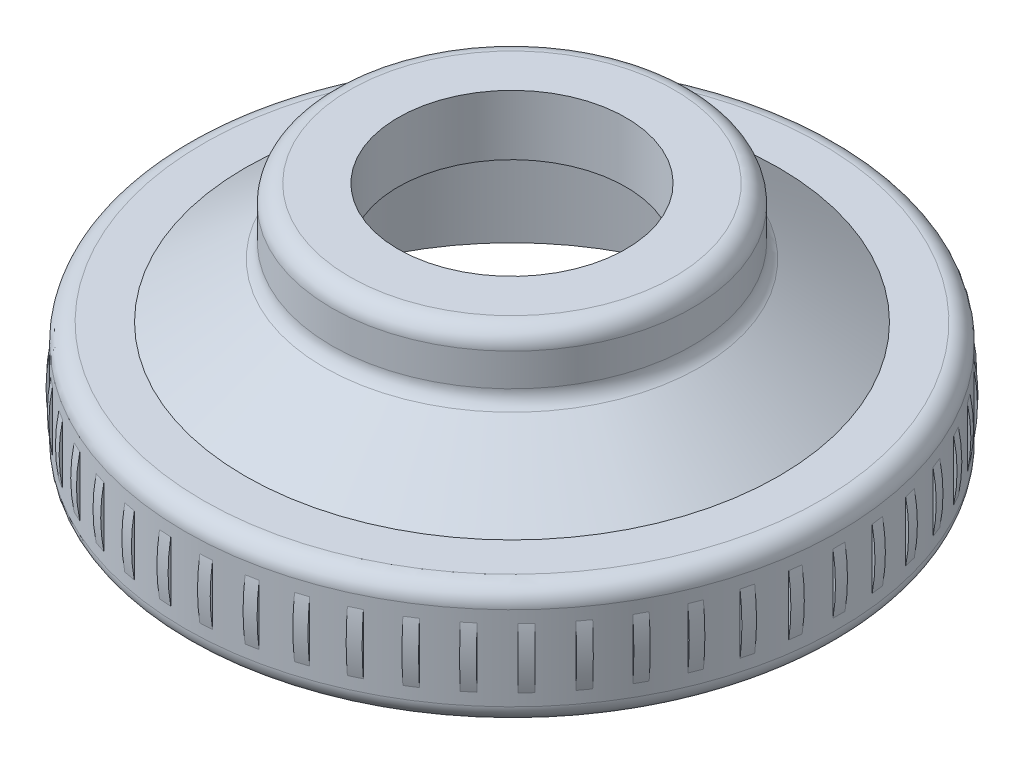
from build123d import *

# Parameters (mm, degrees)
SKETCH1_R                = 27.225
SKETCH1_R_2              = 22.225
BOSS_EXTRUDE1_DEPTH      = 10
SKETCH5_R                = 15
BOSS_EXTRUDE3_DEPTH      = 5
SKETCH9_W                = 9.4869
SKETCH9_H                = 20
FILLET3_R                = 1.5
FILLET5_R                = 1.5
BOSS_EXTRUDE4_DEPTH      = 0.5
BOSS_EXTRUDE4_DEPTH_BACK = 0.5
FILLET6_R                = 15
CIRPATTERN2_COUNT        = 50


with BuildPart() as part:
    # Sketch1 → Boss-Extrude1 (new body)
    with BuildSketch(Plane(origin=(0, 0, 0), x_dir=(1, 0, 0), z_dir=(0, 1, 0))):
        with Locations(Location((0, 0, 0), (0, 0, 270))):
            Circle(SKETCH1_R)
        with Locations(Location((0, 0, 0), (0, 0, 270))):
            Circle(SKETCH1_R_2, mode=Mode.SUBTRACT)
    extrude(amount=BOSS_EXTRUDE1_DEPTH)

    # Fillet5
    fillet5_edges = [part.edges().sort_by_distance(p)[0] for p in [
        (0, 0, -27.225),
        (0, 10, -27.225),
    ]]
    fillet(fillet5_edges, radius=FILLET5_R)


with BuildPart() as body_2:
    # Revolve1: read off the stored shape, not the designer's step
    # Revolve1 outline → Revolve1 (revolve)
    with BuildSketch(Plane.XY):
        Polygon((10, 15), (17.225, 10), (22.225, 10), (15, 15), align=None)
    revolve(axis=Axis((0, 0, 0), (0, 1, 0)))



with BuildPart() as body_3:
    # Revolve1 2 outline → Revolve1 2 (revolve)
    with BuildSketch(Plane.XY):
        Polygon((15, 15), (10, 15), (17.225, 10), (22.225, 10), align=None)
    revolve(axis=Axis((0, 0, 0), (0, 1, 0)))


with BuildPart() as body_2_1:
    add(body_2.part)

    add(body_3.part)  # Boss-Extrude3 merges body 3
    # Sketch5 → Boss-Extrude3 (add)
    with BuildSketch(Plane(origin=(0, 15, 0), x_dir=(1, 0, 0), z_dir=(0, 1, 0))):
        with Locations(Location((0, 0, 0), (0, 0, 270))):
            Circle(SKETCH5_R)
    extrude(amount=BOSS_EXTRUDE3_DEPTH)

    # Sketch9 → Taladro roscado 1/2-14 NPSM1 (revolve, cut)
    with BuildSketch(Plane(origin=(0, 20, 0), x_dir=(0, 0, 1), z_dir=(1, 0, 0))):
        with Locations((4.74345, 10)):
            Rectangle(SKETCH9_W, SKETCH9_H)
    revolve(axis=Axis((0, 26.35, 0), (0, -1, 0)), mode=Mode.SUBTRACT)

    # Fillet3
    fillet3_edges = [body_2_1.edges().sort_by_distance(p)[0] for p in [
        (0, 20, -15),
        (-10.606601718, 15, -10.606601718),
    ]]
    fillet(fillet3_edges, radius=FILLET3_R)


with BuildPart() as body_3_2:
    # Sketch10 → Boss-Extrude4 (new, two sides: drawn at the far end of the back side and taken through both)
    with BuildSketch(Plane.XY.offset(-BOSS_EXTRUDE4_DEPTH_BACK)):
        Polygon((27.225, 7.5), (27.675, 5), (27.225, 2.5), align=None)
    extrude(amount=BOSS_EXTRUDE4_DEPTH + BOSS_EXTRUDE4_DEPTH_BACK)

    # Fillet6
    # the kernel refuses this fillet: 15 mm, written as the material it takes off along each edge
    with BuildSketch(Plane(origin=(27.675, 5, 7.243714089), x_dir=(-0.17715299831526438, 0.9841833239736956, 0), z_dir=(0, 0, -1))) as fillet6_piece_1:
        with BuildLine():
            CenterArc((2.697485635, -15), FILLET6_R, 90, 19.788455744)
            Line((-2.380739461, -0.885764992), (-2.482303963, -0.603480291))
            ThreePointArc((-2.482303963, -0.603480291), (-1.294980346, -0.161712407), (-0.104610616, 0.281170089))
            Line((-0.104610616, 0.281170089), (0, 0.3))
            Line((0, 0.3), (2.697485635, 0.3))
            Line((2.697485635, 0.3), (2.697485635, 0))
        make_face()
    extrude(amount=14.487428177, mode=Mode.SUBTRACT)


with BuildPart() as cirpattern2_1:
    # CirPattern2: pattern copy
    add(body_3_2.part.rotate(Axis((0, 0, 0), (0, 1, 0)), 1 * 360 / CIRPATTERN2_COUNT))


with BuildPart() as cirpattern2_2:
    # CirPattern2: pattern copy
    add(body_3_2.part.rotate(Axis((0, 0, 0), (0, 1, 0)), 2 * 360 / CIRPATTERN2_COUNT))


with BuildPart() as cirpattern2_3:
    # CirPattern2: pattern copy
    add(body_3_2.part.rotate(Axis((0, 0, 0), (0, 1, 0)), 3 * 360 / CIRPATTERN2_COUNT))


with BuildPart() as cirpattern2_4:
    # CirPattern2: pattern copy
    add(body_3_2.part.rotate(Axis((0, 0, 0), (0, 1, 0)), 4 * 360 / CIRPATTERN2_COUNT))


with BuildPart() as cirpattern2_5:
    # CirPattern2: pattern copy
    add(body_3_2.part.rotate(Axis((0, 0, 0), (0, 1, 0)), 5 * 360 / CIRPATTERN2_COUNT))


with BuildPart() as cirpattern2_6:
    # CirPattern2: pattern copy
    add(body_3_2.part.rotate(Axis((0, 0, 0), (0, 1, 0)), 6 * 360 / CIRPATTERN2_COUNT))


with BuildPart() as cirpattern2_7:
    # CirPattern2: pattern copy
    add(body_3_2.part.rotate(Axis((0, 0, 0), (0, 1, 0)), 7 * 360 / CIRPATTERN2_COUNT))


with BuildPart() as cirpattern2_8:
    # CirPattern2: pattern copy
    add(body_3_2.part.rotate(Axis((0, 0, 0), (0, 1, 0)), 8 * 360 / CIRPATTERN2_COUNT))


with BuildPart() as cirpattern2_9:
    # CirPattern2: pattern copy
    add(body_3_2.part.rotate(Axis((0, 0, 0), (0, 1, 0)), 9 * 360 / CIRPATTERN2_COUNT))


with BuildPart() as cirpattern2_10:
    # CirPattern2: pattern copy
    add(body_3_2.part.rotate(Axis((0, 0, 0), (0, 1, 0)), 10 * 360 / CIRPATTERN2_COUNT))


with BuildPart() as cirpattern2_11:
    # CirPattern2: pattern copy
    add(body_3_2.part.rotate(Axis((0, 0, 0), (0, 1, 0)), 11 * 360 / CIRPATTERN2_COUNT))


with BuildPart() as cirpattern2_12:
    # CirPattern2: pattern copy
    add(body_3_2.part.rotate(Axis((0, 0, 0), (0, 1, 0)), 12 * 360 / CIRPATTERN2_COUNT))


with BuildPart() as cirpattern2_13:
    # CirPattern2: pattern copy
    add(body_3_2.part.rotate(Axis((0, 0, 0), (0, 1, 0)), 13 * 360 / CIRPATTERN2_COUNT))


with BuildPart() as cirpattern2_14:
    # CirPattern2: pattern copy
    add(body_3_2.part.rotate(Axis((0, 0, 0), (0, 1, 0)), 14 * 360 / CIRPATTERN2_COUNT))


with BuildPart() as cirpattern2_15:
    # CirPattern2: pattern copy
    add(body_3_2.part.rotate(Axis((0, 0, 0), (0, 1, 0)), 15 * 360 / CIRPATTERN2_COUNT))


with BuildPart() as cirpattern2_16:
    # CirPattern2: pattern copy
    add(body_3_2.part.rotate(Axis((0, 0, 0), (0, 1, 0)), 16 * 360 / CIRPATTERN2_COUNT))


with BuildPart() as cirpattern2_17:
    # CirPattern2: pattern copy
    add(body_3_2.part.rotate(Axis((0, 0, 0), (0, 1, 0)), 17 * 360 / CIRPATTERN2_COUNT))


with BuildPart() as cirpattern2_18:
    # CirPattern2: pattern copy
    add(body_3_2.part.rotate(Axis((0, 0, 0), (0, 1, 0)), 18 * 360 / CIRPATTERN2_COUNT))


with BuildPart() as cirpattern2_19:
    # CirPattern2: pattern copy
    add(body_3_2.part.rotate(Axis((0, 0, 0), (0, 1, 0)), 19 * 360 / CIRPATTERN2_COUNT))


with BuildPart() as cirpattern2_20:
    # CirPattern2: pattern copy
    add(body_3_2.part.rotate(Axis((0, 0, 0), (0, 1, 0)), 20 * 360 / CIRPATTERN2_COUNT))


with BuildPart() as cirpattern2_21:
    # CirPattern2: pattern copy
    add(body_3_2.part.rotate(Axis((0, 0, 0), (0, 1, 0)), 21 * 360 / CIRPATTERN2_COUNT))


with BuildPart() as cirpattern2_22:
    # CirPattern2: pattern copy
    add(body_3_2.part.rotate(Axis((0, 0, 0), (0, 1, 0)), 22 * 360 / CIRPATTERN2_COUNT))


with BuildPart() as cirpattern2_23:
    # CirPattern2: pattern copy
    add(body_3_2.part.rotate(Axis((0, 0, 0), (0, 1, 0)), 23 * 360 / CIRPATTERN2_COUNT))


with BuildPart() as cirpattern2_24:
    # CirPattern2: pattern copy
    add(body_3_2.part.rotate(Axis((0, 0, 0), (0, 1, 0)), 24 * 360 / CIRPATTERN2_COUNT))


with BuildPart() as cirpattern2_25:
    # CirPattern2: pattern copy
    add(body_3_2.part.rotate(Axis((0, 0, 0), (0, 1, 0)), 25 * 360 / CIRPATTERN2_COUNT))


with BuildPart() as cirpattern2_26:
    # CirPattern2: pattern copy
    add(body_3_2.part.rotate(Axis((0, 0, 0), (0, 1, 0)), 26 * 360 / CIRPATTERN2_COUNT))


with BuildPart() as cirpattern2_27:
    # CirPattern2: pattern copy
    add(body_3_2.part.rotate(Axis((0, 0, 0), (0, 1, 0)), 27 * 360 / CIRPATTERN2_COUNT))


with BuildPart() as cirpattern2_28:
    # CirPattern2: pattern copy
    add(body_3_2.part.rotate(Axis((0, 0, 0), (0, 1, 0)), 28 * 360 / CIRPATTERN2_COUNT))


with BuildPart() as cirpattern2_29:
    # CirPattern2: pattern copy
    add(body_3_2.part.rotate(Axis((0, 0, 0), (0, 1, 0)), 29 * 360 / CIRPATTERN2_COUNT))


with BuildPart() as cirpattern2_30:
    # CirPattern2: pattern copy
    add(body_3_2.part.rotate(Axis((0, 0, 0), (0, 1, 0)), 30 * 360 / CIRPATTERN2_COUNT))


with BuildPart() as cirpattern2_31:
    # CirPattern2: pattern copy
    add(body_3_2.part.rotate(Axis((0, 0, 0), (0, 1, 0)), 31 * 360 / CIRPATTERN2_COUNT))


with BuildPart() as cirpattern2_32:
    # CirPattern2: pattern copy
    add(body_3_2.part.rotate(Axis((0, 0, 0), (0, 1, 0)), 32 * 360 / CIRPATTERN2_COUNT))


with BuildPart() as cirpattern2_33:
    # CirPattern2: pattern copy
    add(body_3_2.part.rotate(Axis((0, 0, 0), (0, 1, 0)), 33 * 360 / CIRPATTERN2_COUNT))


with BuildPart() as cirpattern2_34:
    # CirPattern2: pattern copy
    add(body_3_2.part.rotate(Axis((0, 0, 0), (0, 1, 0)), 34 * 360 / CIRPATTERN2_COUNT))


with BuildPart() as cirpattern2_35:
    # CirPattern2: pattern copy
    add(body_3_2.part.rotate(Axis((0, 0, 0), (0, 1, 0)), 35 * 360 / CIRPATTERN2_COUNT))


with BuildPart() as cirpattern2_36:
    # CirPattern2: pattern copy
    add(body_3_2.part.rotate(Axis((0, 0, 0), (0, 1, 0)), 36 * 360 / CIRPATTERN2_COUNT))


with BuildPart() as cirpattern2_37:
    # CirPattern2: pattern copy
    add(body_3_2.part.rotate(Axis((0, 0, 0), (0, 1, 0)), 37 * 360 / CIRPATTERN2_COUNT))


with BuildPart() as cirpattern2_38:
    # CirPattern2: pattern copy
    add(body_3_2.part.rotate(Axis((0, 0, 0), (0, 1, 0)), 38 * 360 / CIRPATTERN2_COUNT))


with BuildPart() as cirpattern2_39:
    # CirPattern2: pattern copy
    add(body_3_2.part.rotate(Axis((0, 0, 0), (0, 1, 0)), 39 * 360 / CIRPATTERN2_COUNT))


with BuildPart() as cirpattern2_40:
    # CirPattern2: pattern copy
    add(body_3_2.part.rotate(Axis((0, 0, 0), (0, 1, 0)), 40 * 360 / CIRPATTERN2_COUNT))


with BuildPart() as cirpattern2_41:
    # CirPattern2: pattern copy
    add(body_3_2.part.rotate(Axis((0, 0, 0), (0, 1, 0)), 41 * 360 / CIRPATTERN2_COUNT))


with BuildPart() as cirpattern2_42:
    # CirPattern2: pattern copy
    add(body_3_2.part.rotate(Axis((0, 0, 0), (0, 1, 0)), 42 * 360 / CIRPATTERN2_COUNT))


with BuildPart() as cirpattern2_43:
    # CirPattern2: pattern copy
    add(body_3_2.part.rotate(Axis((0, 0, 0), (0, 1, 0)), 43 * 360 / CIRPATTERN2_COUNT))


with BuildPart() as cirpattern2_44:
    # CirPattern2: pattern copy
    add(body_3_2.part.rotate(Axis((0, 0, 0), (0, 1, 0)), 44 * 360 / CIRPATTERN2_COUNT))


with BuildPart() as cirpattern2_45:
    # CirPattern2: pattern copy
    add(body_3_2.part.rotate(Axis((0, 0, 0), (0, 1, 0)), 45 * 360 / CIRPATTERN2_COUNT))


with BuildPart() as cirpattern2_46:
    # CirPattern2: pattern copy
    add(body_3_2.part.rotate(Axis((0, 0, 0), (0, 1, 0)), 46 * 360 / CIRPATTERN2_COUNT))


with BuildPart() as cirpattern2_47:
    # CirPattern2: pattern copy
    add(body_3_2.part.rotate(Axis((0, 0, 0), (0, 1, 0)), 47 * 360 / CIRPATTERN2_COUNT))


with BuildPart() as cirpattern2_48:
    # CirPattern2: pattern copy
    add(body_3_2.part.rotate(Axis((0, 0, 0), (0, 1, 0)), 48 * 360 / CIRPATTERN2_COUNT))


with BuildPart() as cirpattern2_49:
    # CirPattern2: pattern copy
    add(body_3_2.part.rotate(Axis((0, 0, 0), (0, 1, 0)), 49 * 360 / CIRPATTERN2_COUNT))


solid = Compound([part.part, body_2_1.part, body_3_2.part, cirpattern2_1.part, cirpattern2_2.part, cirpattern2_3.part, cirpattern2_4.part, cirpattern2_5.part, cirpattern2_6.part, cirpattern2_7.part, cirpattern2_8.part, cirpattern2_9.part, cirpattern2_10.part, cirpattern2_11.part, cirpattern2_12.part, cirpattern2_13.part, cirpattern2_14.part, cirpattern2_15.part, cirpattern2_16.part, cirpattern2_17.part, cirpattern2_18.part, cirpattern2_19.part, cirpattern2_20.part, cirpattern2_21.part, cirpattern2_22.part, cirpattern2_23.part, cirpattern2_24.part, cirpattern2_25.part, cirpattern2_26.part, cirpattern2_27.part, cirpattern2_28.part, cirpattern2_29.part, cirpattern2_30.part, cirpattern2_31.part, cirpattern2_32.part, cirpattern2_33.part, cirpattern2_34.part, cirpattern2_35.part, cirpattern2_36.part, cirpattern2_37.part, cirpattern2_38.part, cirpattern2_39.part, cirpattern2_40.part, cirpattern2_41.part, cirpattern2_42.part, cirpattern2_43.part, cirpattern2_44.part, cirpattern2_45.part, cirpattern2_46.part, cirpattern2_47.part, cirpattern2_48.part, cirpattern2_49.part])
